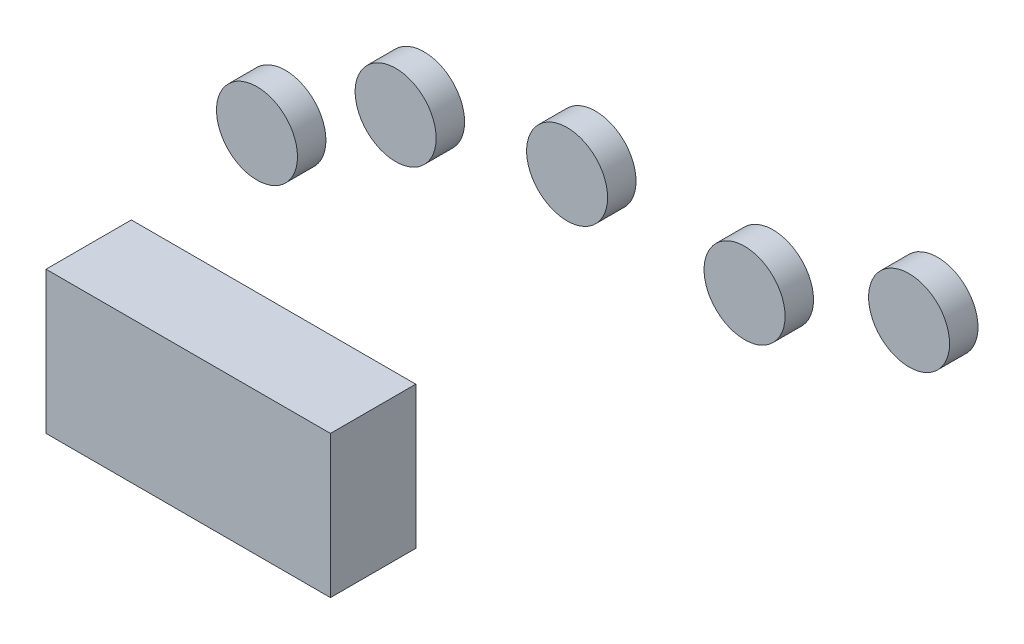
from build123d import *

# Parameters (mm, degrees)
SKETCH_1_R                = 14.233343999
EXTRUDE_1_DEPTH           = 10
PATTERN_CURVE_1_OUTLINE_R = 14.233343999
PATTERN_CURVE_1_DEPTH     = 10
SKETCH_3_W                = 100
SKETCH_3_H                = 50
EXTRUDE_2_DEPTH           = 30


# Read off the part's stored shape, not the designer's step: 曲线阵列1
with BuildPart() as part:
    # 草图1 → 凸台-拉伸1 (new body)
    with BuildSketch(Plane.XY):
        Circle(SKETCH_1_R)
    extrude(amount=EXTRUDE_1_DEPTH)


with BuildPart() as body_2:
    # 曲线阵列1 outline → 曲线阵列1 (new body)
    with BuildSketch(Plane.XY):
        with Locations((229.249642157, 57.71200111)):
            Circle(PATTERN_CURVE_1_OUTLINE_R)
        with Locations((171.415989903, 37.130735449)):
            Circle(PATTERN_CURVE_1_OUTLINE_R)
        with Locations((109.024703037, 42.084293113)):
            Circle(PATTERN_CURVE_1_OUTLINE_R)
        with Locations((48.745932251, 29.993869517)):
            Circle(PATTERN_CURVE_1_OUTLINE_R)
    extrude(amount=PATTERN_CURVE_1_DEPTH)


with BuildPart() as body_3:
    # 草图3 → 凸台-拉伸2 (new body)
    with BuildSketch(Plane.XY.offset(100)):
        with Locations((95.826241383, 16.571381789)):
            Rectangle(SKETCH_3_W, SKETCH_3_H)
    extrude(amount=EXTRUDE_2_DEPTH)


solid = Compound([part.part, body_2.part, body_3.part])
